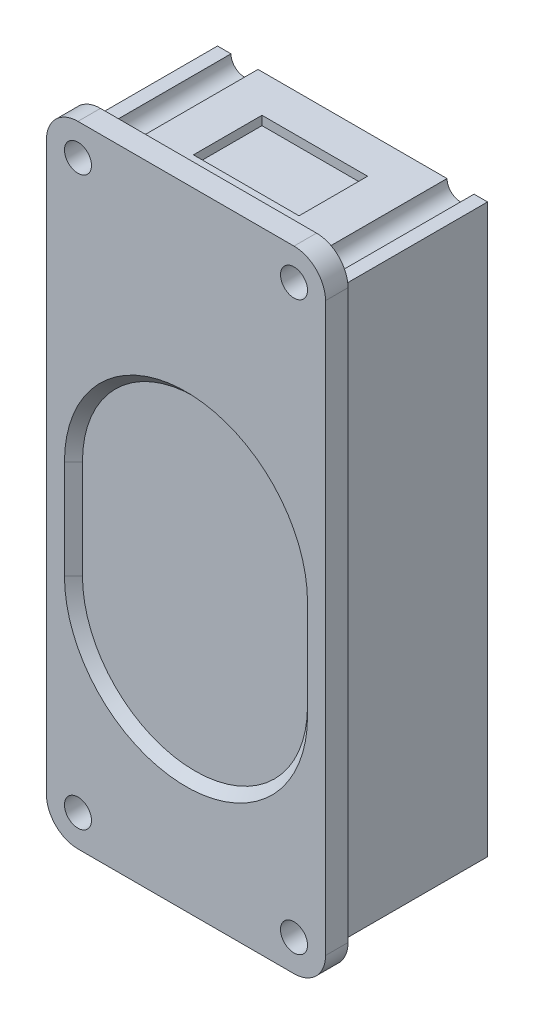
from build123d import *

# Parameters (mm, degrees)
BOSS_EXTRUDE1_DEPTH     = 2.5
SKETCH3_W               = 16
SKETCH3_H               = 63
BOSS_EXTRUDE2_DEPTH     = 15
CUT_EXTRUDE1_DEPTH      = 42.487950058
CUT_EXTRUDE1_DEPTH_BACK = 42.487950058
SKETCH2_R               = 1.5
CUT_EXTRUDE2_DEPTH      = 1
CUT_EXTRUDE2_DRAFT      = -45
SKETCH5_W               = 11.73250701
SKETCH5_H               = 7.616061756
CUT_EXTRUDE3_DEPTH      = 1


with BuildPart() as part:
    # Sketch1 → Boss-Extrude1 (new body)
    with BuildSketch(Plane.XY):
        with BuildLine():
            Line((-12, 35), (12, 35))
            ThreePointArc((12, 35), (14.474873734, 33.974873734), (15.5, 31.5))
            Line((15.5, 31.5), (15.5, -31.5))
            ThreePointArc((15.5, -31.5), (14.474873734, -33.974873734), (12, -35))
            Line((12, -35), (-12, -35))
            ThreePointArc((-12, -35), (-14.474873734, -33.974873734), (-15.5, -31.5))
            Line((-15.5, -31.5), (-15.5, 31.5))
            ThreePointArc((-15.5, 31.5), (-14.474873734, 33.974873734), (-12, 35))
        make_face()
    extrude(amount=BOSS_EXTRUDE1_DEPTH)

    # Sketch3 → Boss-Extrude2 (add, symmetric)
    with BuildSketch(Plane(origin=(0, 0, 0), x_dir=(0, 0, -1), z_dir=(1, 0, 0))):
        with Locations((8, 0)):
            Rectangle(SKETCH3_W, SKETCH3_H)
    extrude(amount=BOSS_EXTRUDE2_DEPTH, both=True)

    # Sketch2 → Cut-Extrude1 (cut, two sides: drawn at the far end of the back side and taken through both)
    with BuildSketch(Plane.XY.offset(-CUT_EXTRUDE1_DEPTH_BACK)):
        with Locations((-12, -31.5)):
            Circle(SKETCH2_R)
        with Locations((12, -31.5)):
            Circle(SKETCH2_R)
        with Locations((12, 31.5)):
            Circle(SKETCH2_R)
        with Locations((-12, 31.5)):
            Circle(SKETCH2_R)
    extrude(amount=CUT_EXTRUDE1_DEPTH + CUT_EXTRUDE1_DEPTH_BACK, mode=Mode.SUBTRACT)


with BuildPart() as cut_extrude2_tool:
    # Sketch4 → Cut-Extrude2 (with draft: the straight prism first)
    with BuildSketch(Plane.XY.offset(2.5)):
        with BuildLine():
            ThreePointArc((13.5, 1.5), (0, 15), (-13.5, 1.5))
            Line((-13.5, 1.5), (-13.5, -9.5))
            ThreePointArc((-13.5, -9.5), (0, -23), (13.5, -9.5))
            Line((13.5, -9.5), (13.5, 1.5))
        make_face()
    extrude(amount=-CUT_EXTRUDE2_DEPTH)
    # Cut-Extrude2: the draft: its side faces are tilted about the plane it starts from
    cut_extrude2_sides = [cut_extrude2_tool.faces().sort_by_distance(p)[0] for p in [
        (13.5, -4, 2),
        (0, 15, 2),
        (-13.5, -4, 2),
        (0, -23, 2),
    ]]
    draft(cut_extrude2_sides, Plane.XY.offset(2.5), CUT_EXTRUDE2_DRAFT)


with BuildPart() as part_1:
    add(part.part)

    # Cut-Extrude2: cut by cut_extrude2_tool
    add(cut_extrude2_tool.part, mode=Mode.SUBTRACT)

    # Sketch5 → Cut-Extrude3 (cut)
    with BuildSketch(Plane(origin=(0, 31.5, 0), x_dir=(1, 0, 0), z_dir=(0, 1, 0))):
        with Locations((0, 8)):
            Rectangle(SKETCH5_W, SKETCH5_H)
    extrude(amount=-CUT_EXTRUDE3_DEPTH, mode=Mode.SUBTRACT)


solid = part_1.part
